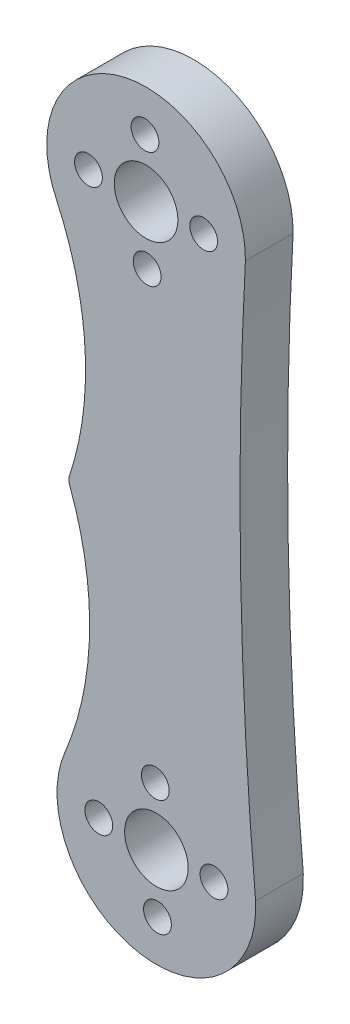
from build123d import *

# Parameters (mm, degrees)
SKETCH1_W           = 30
SKETCH1_H           = 100
BOSS_EXTRUDE1_DEPTH = 6
SKETCH2_W           = 30
SKETCH2_H           = 100
SKETCH2_R           = 4
SKETCH2_R_2         = 1.75
CUT_EXTRUDE1_DEPTH  = 6


with BuildPart() as part:
    # Sketch1 → Boss-Extrude1 (new body)
    with BuildSketch(Plane.XY):
        Rectangle(SKETCH1_W, SKETCH1_H)
    extrude(amount=BOSS_EXTRUDE1_DEPTH)

    # Sketch2 → Cut-Extrude1 (cut)
    # profile 1 of 11: a face of its own
    with BuildSketch(Plane(origin=(0, 0, 0), x_dir=(-1, 0, 0), z_dir=(0, 0, -1))):
        Rectangle(SKETCH2_W, SKETCH2_H)
        with BuildLine():
            ThreePointArc((-12.814966119, -33.667586637), (-10.931527192, 0.86004689), (-11.532456366, 35.433789865))
            ThreePointArc((-11.532456366, 35.433789865), (3.559219809, 47.87326117), (12.302107664, 30.37866063))
            ThreePointArc((12.302107664, 30.37866063), (8.644900126, 15.830443683), (10.603989757, 0.958061522))
            ThreePointArc((10.603989757, 0.958061522), (10.679689693, 0.458946393), (10.585521288, -0.037016008))
            ThreePointArc((10.585521288, -0.037016008), (8.075913228, -14.826459902), (11.190763167, -29.50036508))
            ThreePointArc((11.190763167, -29.50036508), (1.804726533, -46.658495876), (-12.814966119, -33.667586637))
        make_face(mode=Mode.SUBTRACT)
    # profile 2 of 11: a face of its own
    with BuildSketch(Plane(origin=(0, 0, 0), x_dir=(-1, 0, 0), z_dir=(0, 0, -1))):
        with Locations((0.965754671, 35.645263027)):
            Circle(SKETCH2_R)
    # profile 3 of 11: a face of its own
    with BuildSketch(Plane(origin=(0, 0, 0), x_dir=(-1, 0, 0), z_dir=(0, 0, -1))):
        with Locations((1.100290264, 42.894014656)):
            Circle(SKETCH2_R_2)
    # profile 4 of 11: a face of its own
    with BuildSketch(Plane(origin=(0, 0, 0), x_dir=(-1, 0, 0), z_dir=(0, 0, -1))):
        with Locations((8.214506299, 35.510727434)):
            Circle(SKETCH2_R_2)
    # profile 5 of 11: a face of its own
    with BuildSketch(Plane(origin=(0, 0, 0), x_dir=(-1, 0, 0), z_dir=(0, 0, -1))):
        with Locations((-6.282996958, 35.77979862)):
            Circle(SKETCH2_R_2)
    # profile 6 of 11: a face of its own
    with BuildSketch(Plane(origin=(0, 0, 0), x_dir=(-1, 0, 0), z_dir=(0, 0, -1))):
        with Locations((0.831219078, 28.396511399)):
            Circle(SKETCH2_R_2)
    # profile 7 of 11: a face of its own
    with BuildSketch(Plane(origin=(0, 0, 0), x_dir=(-1, 0, 0), z_dir=(0, 0, -1))):
        with Locations((-0.333209676, -34.342683732)):
            Circle(SKETCH2_R)
    # profile 8 of 11: a face of its own
    with BuildSketch(Plane(origin=(0, 0, 0), x_dir=(-1, 0, 0), z_dir=(0, 0, -1))):
        with Locations((-0.198674083, -27.093932103)):
            Circle(SKETCH2_R_2)
    # profile 9 of 11: a face of its own
    with BuildSketch(Plane(origin=(0, 0, 0), x_dir=(-1, 0, 0), z_dir=(0, 0, -1))):
        with Locations((6.915541953, -34.477219325)):
            Circle(SKETCH2_R_2)
    # profile 10 of 11: a face of its own
    with BuildSketch(Plane(origin=(0, 0, 0), x_dir=(-1, 0, 0), z_dir=(0, 0, -1))):
        with Locations((-0.467745269, -41.591435361)):
            Circle(SKETCH2_R_2)
    # profile 11 of 11: a face of its own
    with BuildSketch(Plane(origin=(0, 0, 0), x_dir=(-1, 0, 0), z_dir=(0, 0, -1))):
        with Locations((-7.581961304, -34.208148139)):
            Circle(SKETCH2_R_2)
    extrude(amount=-CUT_EXTRUDE1_DEPTH, mode=Mode.SUBTRACT)


solid = part.part
